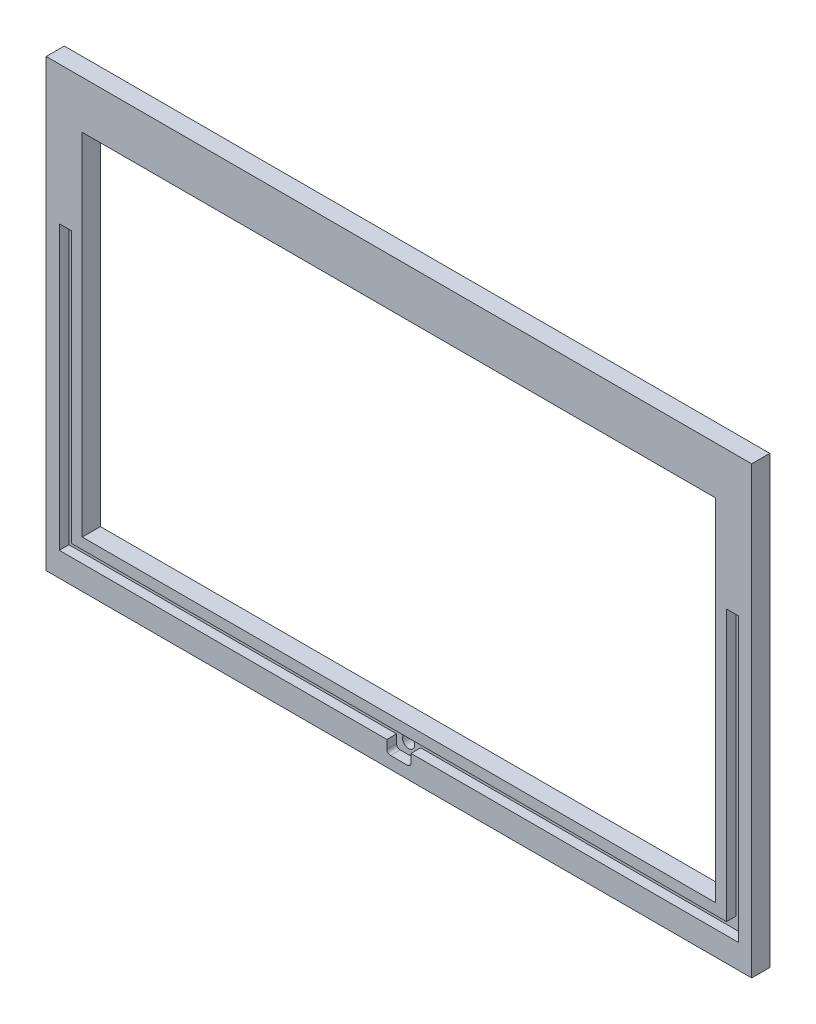
from build123d import *

# Parameters (mm, degrees)
EXTRUDE_1_OUTLINE_W = 563.7
EXTRUDE_1_OUTLINE_H = 348.4
EXTRUDE_1_DEPTH     = 15
SKETCH_3_W          = 524
SKETCH_3_H          = 290
CUT_EXTRUDE_1_DEPTH = 70
SKETCH_4_W          = 10
SKETCH_4_H          = 348.4
EXTRUDE_2_DEPTH     = 15
SKETCH_5_W          = 583.7
SKETCH_5_H          = 20
EXTRUDE_3_DEPTH     = 15
SKETCH_6_W          = 10
SKETCH_6_H          = 224
CUT_EXTRUDE_2_DEPTH = 8
SKETCH_7_R          = 5
CUT_EXTRUDE_3_DEPTH = 10


# Read off the part's stored shape, not the designer's step: 填料-伸長1
with BuildPart() as part:
    # 填料-伸長1 outline → 填料-伸長1 (new body)
    with BuildSketch(Plane.XY):
        with Locations((83.50571914, 42.111680092)):
            Rectangle(EXTRUDE_1_OUTLINE_W, EXTRUDE_1_OUTLINE_H)
    extrude(amount=EXTRUDE_1_DEPTH)

    # 草圖3 → 除料-伸長1 (cut)
    with BuildSketch(Plane.XY.offset(15)):
        with Locations((83.50571914, 31.911680092)):
            Rectangle(SKETCH_3_W, SKETCH_3_H)
    extrude(amount=-CUT_EXTRUDE_1_DEPTH, mode=Mode.SUBTRACT)

    # 草圖4 → 填料-伸長2 (add)
    with BuildSketch(Plane.XY.offset(15)):
        with Locations((-203.34428086, 42.111680092)):
            Rectangle(SKETCH_4_W, SKETCH_4_H)
        with Locations((370.35571914, 42.111680092)):
            Rectangle(SKETCH_4_W, SKETCH_4_H)
    extrude(amount=-EXTRUDE_2_DEPTH)

    # 草圖5 → 填料-伸長3 (add)
    with BuildSketch(Plane.XY.offset(15)):
        with Locations((83.50571914, -142.088319908)):
            Rectangle(SKETCH_5_W, SKETCH_5_H)
    extrude(amount=-EXTRUDE_3_DEPTH)

    # 草圖6 → 除料-伸長2 (cut)
    with BuildSketch(Plane.XY.offset(15)):
        Polygon((364.50571914, -132.088319908), (364.50571914, 101.911680092), (354.50571914, 101.911680092), (354.50571914, -122.088319908), (354.50571914, -132.088319908), align=None)
        with BuildLine():
            Line((354.50571914, -132.088319908), (354.50571914, -122.088319908))
            Line((354.50571914, -122.088319908), (93.50571914, -122.088319908))
            Line((93.50571914, -122.088319908), (73.50571914, -122.088319908))
            Line((73.50571914, -122.088319908), (-187.49428086, -122.088319908))
            Line((-187.49428086, -122.088319908), (-197.49428086, -122.088319908))
            Line((-197.49428086, -122.088319908), (-197.49428086, -132.088319908))
            Line((-197.49428086, -132.088319908), (73.50571914, -132.088319908))
            Line((73.50571914, -132.088319908), (73.50571914, -139.088319908))
            ThreePointArc((73.50571914, -139.088319908), (74.384398796, -141.209640251), (76.50571914, -142.088319908))
            Line((76.50571914, -142.088319908), (90.50571914, -142.088319908))
            ThreePointArc((90.50571914, -142.088319908), (92.627039483, -141.209640251), (93.50571914, -139.088319908))
            Line((93.50571914, -139.088319908), (93.50571914, -132.088319908))
            Line((93.50571914, -132.088319908), (354.50571914, -132.088319908))
        make_face()
        with Locations((-192.49428086, -10.088319908)):
            Rectangle(SKETCH_6_W, SKETCH_6_H)
    extrude(amount=-CUT_EXTRUDE_2_DEPTH, mode=Mode.SUBTRACT)

    # 草圖7 → 除料-伸長3 (cut)
    with BuildSketch(Plane.XY.offset(7)):
        with Locations((83.50571914, -132.588319908)):
            Circle(SKETCH_7_R)
    extrude(amount=-CUT_EXTRUDE_3_DEPTH, mode=Mode.SUBTRACT)


solid = part.part
